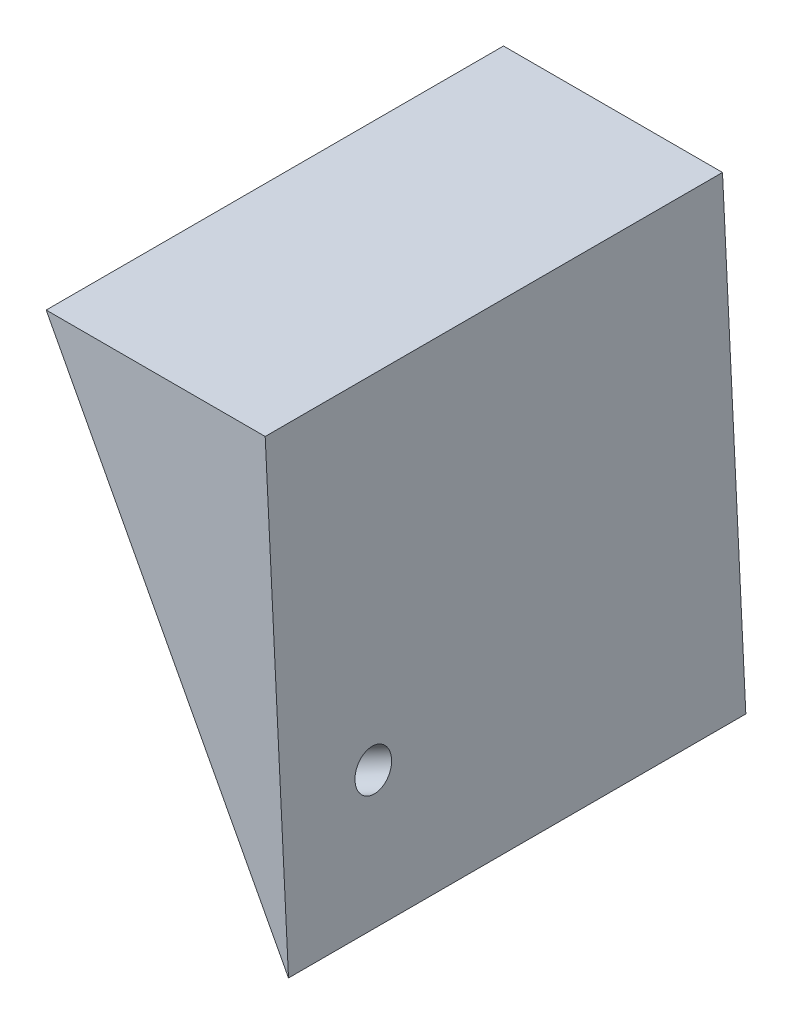
from build123d import *

# Parameters (mm, degrees)
BOSS_EXTRUDE1_DEPTH = 50
SKETCH2_R           = 2
CUT_EXTRUDE1_DEPTH  = 50


with BuildPart() as part:
    # Sketch1 → Boss-Extrude1 (new body)
    with BuildSketch(Plane.XY):
        Polygon((-36.238637744, 19.241346543), (-9.742760301, -30.758653457), (-12.293063224, 19.241346543), align=None)
    extrude(amount=BOSS_EXTRUDE1_DEPTH)

    # Sketch2 → Cut-Extrude1 (cut)
    with BuildSketch(Plane(origin=(-20.332646925, -10.77462642, 0), x_dir=(0, 0, 1), z_dir=(-0.8836030430860086, -0.4682367587547406, 0))):
        with Locations((40, -9.616521291)):
            Circle(SKETCH2_R)
    extrude(amount=-CUT_EXTRUDE1_DEPTH, mode=Mode.SUBTRACT)


solid = part.part
